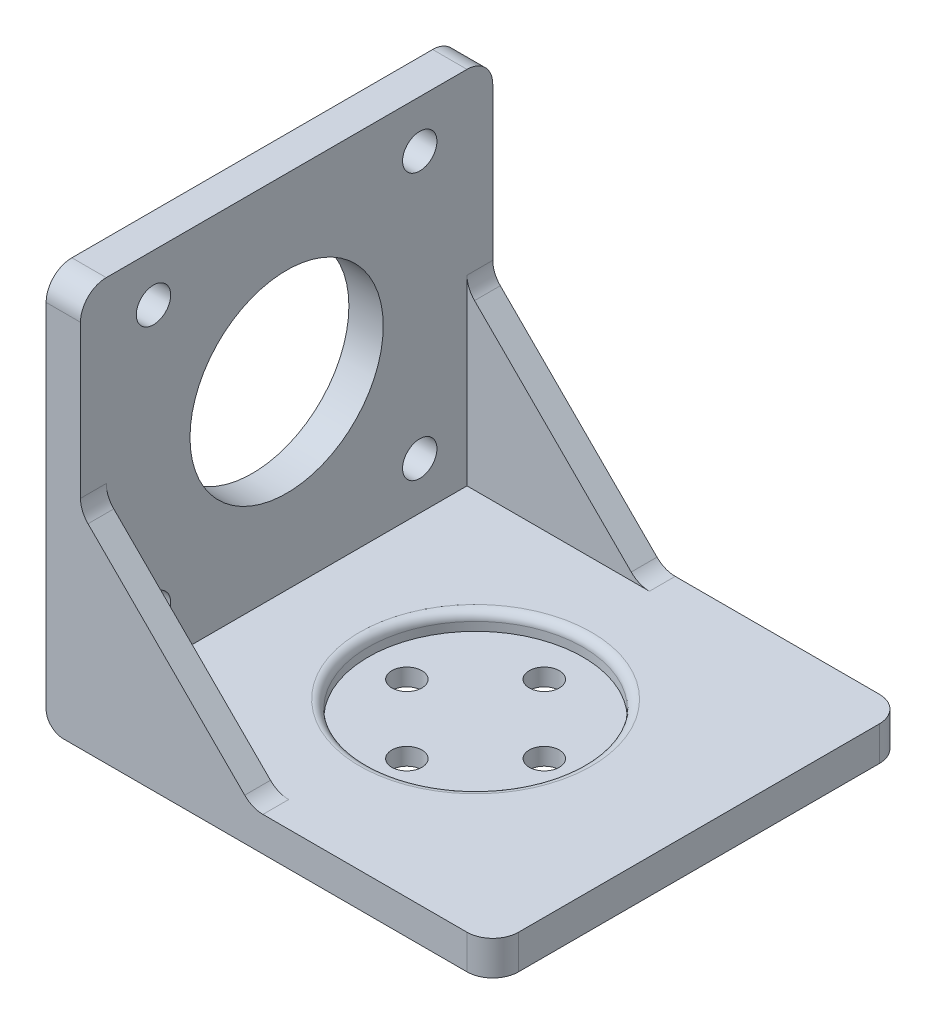
from build123d import *

# Parameters (mm, degrees)
SKETCH_1_W          = 52
SKETCH_1_H          = 42
SKETCH_1_R          = 1.75
EXTRUDE_2_DEPTH     = 4
SKETCH_2_W          = 42
SKETCH_2_H          = 42
SKETCH_2_R          = 2
SKETCH_2_R_2        = 11.25
EXTRUDE_3_DEPTH     = 4
SKETCH_4_R          = 12.5
CUT_EXTRUDE_1_DEPTH = 2
EXTRUDE_4_DEPTH     = 3
EXTRUDE_5_DEPTH     = 3
FILLET_1_R          = 3
FILLET_2_R          = 3
FILLET_3_R          = 3
FILLET_4_R          = 3
FILLET_5_R          = 3
FILLET_6_R          = 3
FILLET_7_R          = 3
FILLET_8_R          = 3
FILLET_9_R          = 1
FILLET_10_R         = 2


with BuildPart() as part:
    # 草图1 → 凸台-拉伸2 (new body)
    with BuildSketch(Plane(origin=(0, 0, 0), x_dir=(1, 0, 0), z_dir=(0, 1, 0))):
        Rectangle(SKETCH_1_W, SKETCH_1_H)
        with Locations((8, 0)):
            Circle(SKETCH_1_R, mode=Mode.SUBTRACT)
        with Locations((0, 8)):
            Circle(SKETCH_1_R, mode=Mode.SUBTRACT)
        with Locations((-8, 0)):
            Circle(SKETCH_1_R, mode=Mode.SUBTRACT)
        with Locations((0, -8)):
            Circle(SKETCH_1_R, mode=Mode.SUBTRACT)
    extrude(amount=EXTRUDE_2_DEPTH)

    # 草图2 → 凸台-拉伸3 (add)
    with BuildSketch(Plane.ZY.offset(26)):
        with Locations((0, 25)):
            Rectangle(SKETCH_2_W, SKETCH_2_H)
        with Locations((15.5, 40.5)):
            Circle(SKETCH_2_R, mode=Mode.SUBTRACT)
        with Locations((15.5, 9.5)):
            Circle(SKETCH_2_R, mode=Mode.SUBTRACT)
        with Locations((-15.5, 9.5)):
            Circle(SKETCH_2_R, mode=Mode.SUBTRACT)
        with Locations((-15.5, 40.5)):
            Circle(SKETCH_2_R, mode=Mode.SUBTRACT)
        with Locations((0, 25)):
            Circle(SKETCH_2_R_2, mode=Mode.SUBTRACT)
    extrude(amount=-EXTRUDE_3_DEPTH)

    # 草图4 → 切除-拉伸1 (cut)
    with BuildSketch(Plane(origin=(0, 4, 0), x_dir=(1, 0, 0), z_dir=(0, 1, 0))):
        Circle(SKETCH_4_R)
    extrude(amount=-CUT_EXTRUDE_1_DEPTH, mode=Mode.SUBTRACT)

    # 草图6 → 凸台-拉伸4 (add)
    with BuildSketch(Plane.XY.offset(21)):
        Polygon((-26, 46), (-22, 46), (-22, 24), (-2, 4), (26, 4), (26, 0), (-26, 0), align=None)
    extrude(amount=EXTRUDE_4_DEPTH)

    # 草图7 → 凸台-拉伸5 (add)
    with BuildSketch(Plane(origin=(0, 0, -21), x_dir=(-1, 0, 0), z_dir=(0, 0, -1))):
        Polygon((26, 46), (26, 0), (-26, 0), (-26, 4), (2, 4), (22, 24), (22, 46), align=None)
    extrude(amount=EXTRUDE_5_DEPTH)

    # 圆角1
    fillet_1_edges = [part.edges().sort_by_distance(p)[0] for p in [
        (-24, 46, 24),
    ]]
    fillet(fillet_1_edges, radius=FILLET_1_R)

    # 圆角2
    fillet_2_edges = [part.edges().sort_by_distance(p)[0] for p in [
        (-24, 46, -24),
    ]]
    fillet(fillet_2_edges, radius=FILLET_2_R)

    # 圆角3
    fillet_3_edges = [part.edges().sort_by_distance(p)[0] for p in [
        (26, 2, 24),
    ]]
    fillet(fillet_3_edges, radius=FILLET_3_R)

    # 圆角4
    fillet_4_edges = [part.edges().sort_by_distance(p)[0] for p in [
        (26, 2, -24),
    ]]
    fillet(fillet_4_edges, radius=FILLET_4_R)

    # 圆角5
    fillet_5_edges = [part.edges().sort_by_distance(p)[0] for p in [
        (-22, 24, 22.5),
    ]]
    fillet(fillet_5_edges, radius=FILLET_5_R)

    # 圆角6
    fillet_6_edges = [part.edges().sort_by_distance(p)[0] for p in [
        (-2, 4, 22.5),
    ]]
    fillet(fillet_6_edges, radius=FILLET_6_R)

    # 圆角7
    fillet_7_edges = [part.edges().sort_by_distance(p)[0] for p in [
        (-22, 24, -22.5),
    ]]
    fillet(fillet_7_edges, radius=FILLET_7_R)

    # 圆角8
    fillet_8_edges = [part.edges().sort_by_distance(p)[0] for p in [
        (-2, 4, -22.5),
    ]]
    fillet(fillet_8_edges, radius=FILLET_8_R)

    # 圆角9
    fillet_9_edges = [part.edges().sort_by_distance(p)[0] for p in [
        (-12.5, 4, 0),
    ]]
    fillet(fillet_9_edges, radius=FILLET_9_R)

    # 圆角10
    fillet_10_edges = [part.edges().sort_by_distance(p)[0] for p in [
        (-26, 0, 0),
    ]]
    fillet(fillet_10_edges, radius=FILLET_10_R)


solid = part.part
